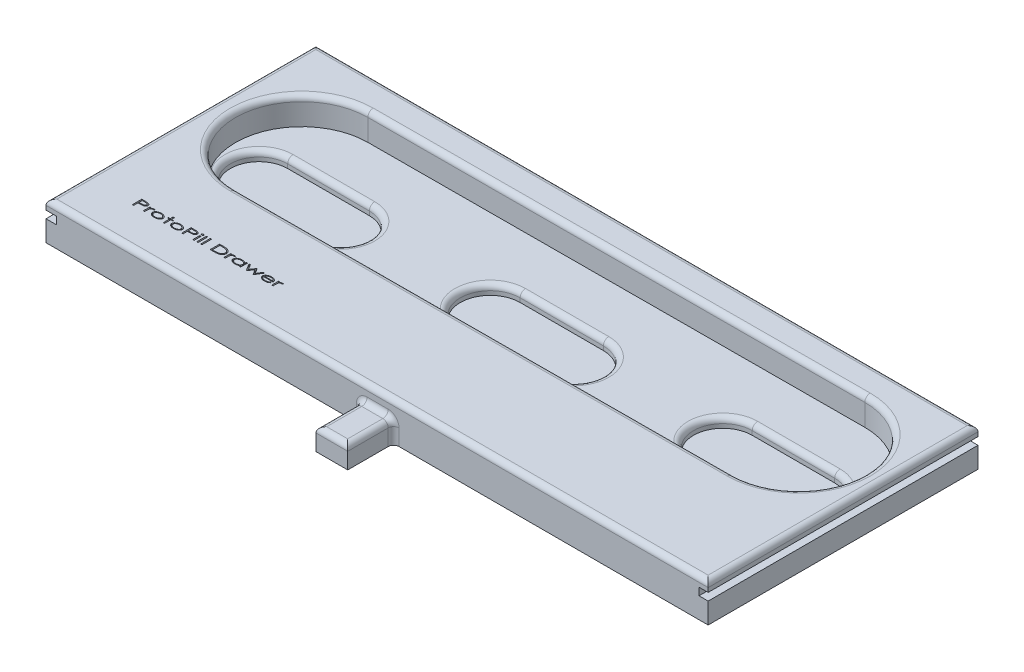
from build123d import *

# Parameters (mm, degrees)
SKETCH1_W           = 245.19434691
SKETCH1_H           = 93
BOSS_EXTRUDE1_DEPTH = 14
SKETCH2_W           = 4.694067914
SKETCH2_H           = 2.762668825
CUT_EXTRUDE1_DEPTH  = 264.350970101
SKETCH7_W           = 11.788952715
SKETCH7_H           = 7.980899871
BOSS_EXTRUDE2_DEPTH = 70
BOSS_EXTRUDE3_DEPTH = 53
CUT_EXTRUDE2_DEPTH  = 10
CUT_EXTRUDE4_DEPTH  = 3.5
FILLET2_R           = 2
FILLET3_R           = 2
SKETCH11_W          = 245.19434691
SKETCH11_H          = 46.073783244
CUT_EXTRUDE5_DEPTH  = 266.276293906
FILLET4_R           = 2
SKETCH12_R          = 3.025
CUT_EXTRUDE6_DEPTH  = 2
SKETCH13_W          = 0.493589743
SKETCH13_H          = 2.557692308
SKETCH13_H_2        = 3.58974359
CUT_EXTRUDE7_DEPTH  = 2
CUT_EXTRUDE8_DEPTH  = 2


with BuildPart() as part:
    # Sketch1 → Boss-Extrude1 (new body)
    with BuildSketch(Plane(origin=(0, 0, 0), x_dir=(1, 0, 0), z_dir=(0, 1, 0))):
        with Locations((123.388056697, 18.180222461)):
            Rectangle(SKETCH1_W, SKETCH1_H)
    extrude(amount=BOSS_EXTRUDE1_DEPTH)

    # Sketch2 → Cut-Extrude1 (cut, through all)
    with BuildSketch(Plane.XY.offset(28.319777539)):
        with Locations((2.347033957, 9.071542246)):
            Rectangle(SKETCH2_W, SKETCH2_H)
    cut_extrude1 = extrude(amount=-CUT_EXTRUDE1_DEPTH, mode=Mode.SUBTRACT)

    # Mirror5: Cut-Extrude1 across plane
    add(cut_extrude1.mirror(Plane(origin=(123.647335387, 0, 0), x_dir=(0, 0, 1), z_dir=(1, 0, 0))), mode=Mode.SUBTRACT)

    # Sketch7 → Boss-Extrude2 (add)
    with BuildSketch(Plane.XY.offset(28.319777539)):
        with Locations((123.619253178, 3.990449936)):
            Rectangle(SKETCH7_W, SKETCH7_H)
    extrude(amount=BOSS_EXTRUDE2_DEPTH)

    # Sketch8 → Boss-Extrude3 (add)
    with BuildSketch(Plane.XY.offset(28.319777539)):
        Polygon((245.985230152, 10.452876658), (245.985230152, 14), (0.790883242, 14), (0.790883242, 10.452876658), (4.694067914, 10.452876658), (4.694067914, 7.690207833), (0.790883242, 7.690207833), (0.790883242, 0), (117.72477682, 0), (117.72477682, 7.980899871), (129.513729535, 7.980899871), (129.513729535, 0), (245.985230152, 0), (245.985230152, 7.690207833), (242.60060286, 7.690207833), (242.60060286, 10.452876658), align=None)
    extrude(amount=BOSS_EXTRUDE3_DEPTH)

    # Sketch9 → Cut-Extrude2 (cut)
    with BuildSketch(Plane(origin=(0, 14, 0), x_dir=(1, 0, 0), z_dir=(0, 1, 0))):
        with BuildLine():
            Line((32.192967626, 6.462131645), (215.586098008, 7.089792499))
            ThreePointArc((215.586098008, 7.089792499), (240.21687673, -17.37296417), (215.754120062, -42.003742891))
            Line((215.754120062, -42.003742891), (32.360989679, -42.631403746))
            ThreePointArc((32.360989679, -42.631403746), (7.730210957, -18.168647077), (32.192967626, 6.462131645))
        make_face()
    extrude(amount=-CUT_EXTRUDE2_DEPTH, mode=Mode.SUBTRACT)

    # Sketch10 → Cut-Extrude4 (cut)
    with BuildSketch(Plane(origin=(0, 4, 0), x_dir=(1, 0, 0), z_dir=(0, 1, 0))):
        with BuildLine():
            Line((22.25591728, -13.271336062), (52.471076918, -13.271336062))
            ThreePointArc((52.471076918, -13.271336062), (63.102678482, -23.902937626), (52.471076918, -34.53453919))
            Line((52.471076918, -34.53453919), (22.25591728, -34.53453919))
            ThreePointArc((22.25591728, -34.53453919), (11.624315716, -23.902937626), (22.25591728, -13.271336062))
        make_face()
        with BuildLine():
            Line((108.253612411, -13.200304135), (139.069681283, -13.200304135))
            ThreePointArc((139.069681283, -13.200304135), (150.155917287, -24.286540139), (139.069681283, -35.372776144))
            Line((139.069681283, -35.372776144), (108.253612411, -35.372776144))
            ThreePointArc((108.253612411, -35.372776144), (97.167376406, -24.286540139), (108.253612411, -13.200304135))
        make_face()
        with BuildLine():
            Line((193.804446674, -12.815543396), (224.338324214, -12.815543396))
            ThreePointArc((224.338324214, -12.815543396), (235.209291929, -23.686511111), (224.338324214, -34.557478826))
            Line((224.338324214, -34.557478826), (193.804446674, -34.557478826))
            ThreePointArc((193.804446674, -34.557478826), (182.933478959, -23.686511111), (193.804446674, -12.815543396))
        make_face()
    extrude(amount=-CUT_EXTRUDE4_DEPTH, mode=Mode.SUBTRACT)

    # Fillet2
    fillet2_edges = [part.edges().sort_by_distance(p)[0] for p in [
        (240.21687673, 14, 17.37296417),
        (124.05755487, 14, 42.317573318),
        (7.730210957, 14, 18.168647077),
        (123.889532817, 14, -6.775962072),
    ]]
    fillet(fillet2_edges, radius=FILLET2_R)

    # Fillet3
    fillet3_edges = [part.edges().sort_by_distance(p)[0] for p in [
        (235.209291929, 4, 23.686511111),
        (209.071385444, 4, 34.557478826),
        (182.933478959, 4, 23.686511111),
        (150.155917287, 4, 24.286540139),
        (123.661646847, 4, 35.372776144),
        (97.167376406, 4, 24.286540139),
        (63.102678482, 4, 23.902937626),
        (37.363497099, 4, 34.53453919),
        (11.624315716, 4, 23.902937626),
        (209.071385444, 4, 12.815543396),
        (123.661646847, 4, 13.200304135),
        (37.363497099, 4, 13.271336062),
    ]]
    fillet(fillet3_edges, radius=FILLET3_R)

    # Sketch11 → Cut-Extrude5 (cut, through all)
    with BuildSketch(Plane(origin=(0, 14, 0), x_dir=(1, 0, 0), z_dir=(0, 1, 0))):
        with Locations((123.388056697, 41.643330839)):
            Rectangle(SKETCH11_W, SKETCH11_H)
    extrude(amount=-CUT_EXTRUDE5_DEPTH, mode=Mode.SUBTRACT)

    # Fillet4
    fillet4_edges = [part.edges().sort_by_distance(p)[0] for p in [
        (117.72477682, 3.990449936, 81.319777539),
        (129.513729535, 3.990449936, 81.319777539),
        (123.619253178, 7.980899871, 98.319777539),
        (117.72477682, 7.980899871, 89.819777539),
        (123.619253178, 7.980899871, 81.319777539),
        (129.513729535, 7.980899871, 89.819777539),
        (245.985230152, 14, 31.356669161),
        (123.388056697, 14, 81.319777539),
        (0.790883242, 14, 31.356669161),
        (123.388056697, 14, -18.606439217),
    ]]
    fillet(fillet4_edges, radius=FILLET4_R)

    # Sketch12 → Cut-Extrude6 (cut)
    with BuildSketch(Plane.XZ):
        with Locations((79.20490952, -2.654606068)):
            Circle(SKETCH12_R)
        with Locations((79.20490952, 6.341887825)):
            Circle(SKETCH12_R)
        with Locations((169.858472383, 5.930696377)):
            Circle(SKETCH12_R)
        with Locations((169.858472383, -2.654606068)):
            Circle(SKETCH12_R)
    extrude(amount=-CUT_EXTRUDE6_DEPTH, mode=Mode.SUBTRACT)

    # Sketch13 → Cut-Extrude7 (cut)
    # profile 1 of 16: a face of its own
    with BuildSketch(Plane(origin=(0, 14, 0), x_dir=(1, 0, 0), z_dir=(0, 1, 0))):
        with BuildLine():
            Line((18.559453652, -63.609154928), (19.589401569, -63.609154928))
            add(Edge.make_bspline(
                [(19.589401569, -63.609154928), (19.660216229, -63.609207816), (19.796009129, -63.609309233), (19.990458636, -63.612311088), (20.166922514, -63.616339403), (20.325381855, -63.621986437), (20.465916911, -63.628417575), (20.588361196, -63.637854069), (20.692806826, -63.647360425), (20.75610385, -63.657252292), (20.784814229, -63.661739063)],
                knots=[0, 0, 0, 0, 1.419177856, 2.721389515, 3.89734153, 4.956527438, 5.899121513, 6.716361902, 7.417765099, 8, 8, 8, 8], degree=3))
            add(Edge.make_bspline(
                [(20.784814229, -63.661739063), (20.820887054, -63.668358554), (20.892034872, -63.681414432), (20.995514197, -63.707401431), (21.093930167, -63.738080351), (21.187023764, -63.77418744), (21.275308065, -63.814482055), (21.358419454, -63.860319671), (21.436467741, -63.910896585), (21.509168984, -63.965877922), (21.575105371, -64.025007934), (21.632608856, -64.088601838), (21.680831646, -64.15611131), (21.721857181, -64.226827444), (21.752422367, -64.301981747), (21.774235543, -64.380809711), (21.788083956, -64.463099368), (21.789502804, -64.519389326), (21.790222883, -64.547957011)],
                knots=[0, 0, 0, 0, 1.202944546, 2.372613736, 3.497786956, 4.582770442, 5.646275108, 6.679186854, 7.693607135, 8.694962411, 9.666642172, 10.595006966, 11.501456956, 12.383984799, 13.271030618, 14.154656858, 15.063470898, 16, 16, 16, 16], degree=3))
            add(Edge.make_bspline(
                [(21.790222883, -64.547957011), (21.789521087, -64.576761689), (21.788143787, -64.633291905), (21.774119081, -64.716000476), (21.752660293, -64.794872573), (21.722045447, -64.869807261), (21.683557714, -64.941214738), (21.635074098, -65.00797268), (21.578906649, -65.07163001), (21.513310562, -65.129978091), (21.440869989, -65.18484635), (21.361600897, -65.235229344), (21.275762005, -65.280811287), (21.183647001, -65.321492741), (21.0849146, -65.357142972), (20.979859337, -65.388653778), (20.867916227, -65.415337146), (20.790732781, -65.429180671), (20.751160383, -65.436278326)],
                knots=[0, 0, 0, 0, 0.922605917, 1.810647271, 2.681294701, 3.538296812, 4.399903948, 5.275180805, 6.177331378, 7.116219832, 8.084190562, 9.088028358, 10.12368074, 11.197019002, 12.313319958, 13.4865942, 14.711362353, 16, 16, 16, 16], degree=3))
            add(Edge.make_bspline(
                [(20.751160383, -65.436278326), (20.718469229, -65.440942875), (20.646706534, -65.451182363), (20.529050496, -65.462594348), (20.392284803, -65.472278622), (20.236346099, -65.479638048), (20.061053197, -65.485869185), (19.866368667, -65.490814558), (19.65227691, -65.493557666), (19.503164369, -65.493697388), (19.425339069, -65.493770313)],
                knots=[0, 0, 0, 0, 0.596701069, 1.309861314, 2.135550679, 3.074303209, 4.130845578, 5.305332262, 6.593590277, 8, 8, 8, 8], degree=3))
            Line((19.425339069, -65.493770313), (19.053043395, -65.493770313))
            Line((19.053043395, -65.493770313), (19.053043395, -67.109154928))
            Line((19.053043395, -67.109154928), (18.559453652, -67.109154928))
            Line((18.559453652, -67.109154928), (18.559453652, -63.609154928))
        make_face()
        with BuildLine():
            Line((19.053043395, -63.968129287), (19.053043395, -65.134795954))
            Line((19.053043395, -65.134795954), (19.953984902, -65.142508294))
            add(Edge.make_bspline(
                [(19.953984902, -65.142508294), (19.99792553, -65.142521334), (20.08301808, -65.142546588), (20.205949603, -65.138570661), (20.319804463, -65.134014923), (20.424328313, -65.127165764), (20.519658494, -65.117805993), (20.606116267, -65.108019692), (20.683188352, -65.094359518), (20.772402579, -65.075649298), (20.871574629, -65.044704061), (20.978955012, -64.998076538), (21.07224247, -64.940131325), (21.152027991, -64.873727987), (21.216190155, -64.800096138), (21.262354089, -64.720428976), (21.291409318, -64.636401283), (21.294894643, -64.578326983), (21.296633139, -64.549359255)],
                knots=[0, 0, 0, 0, 1.302178146, 2.521713123, 3.644833948, 4.679186471, 5.625468095, 6.483724746, 7.256908744, 7.944332482, 9.184328887, 10.328545311, 11.404879146, 12.427406377, 13.395044434, 14.282513672, 15.143309921, 16, 16, 16, 16], degree=3))
            add(Edge.make_bspline(
                [(21.296633139, -64.549359255), (21.29488017, -64.521086999), (21.291349857, -64.464149342), (21.26214629, -64.381617706), (21.216240367, -64.302719484), (21.151826402, -64.230387849), (21.074420468, -64.163622302), (20.983396781, -64.107713567), (20.881682484, -64.060904428), (20.787456502, -64.032245262), (20.703325252, -64.013994903), (20.629883554, -64.00148467), (20.546835613, -63.991071106), (20.454427444, -63.983061843), (20.352767544, -63.975873783), (20.2417168, -63.971162183), (20.121100984, -63.968331153), (20.037420139, -63.968198302), (19.993948844, -63.968129287)],
                knots=[0, 0, 0, 0, 0.85982624, 1.731608922, 2.638175506, 3.627963027, 4.668731374, 5.743984735, 6.872385735, 8.073309669, 8.737023245, 9.49590589, 10.343247817, 11.287432573, 12.322799246, 13.449422509, 14.675002546, 16, 16, 16, 16], degree=3))
            Line((19.993948844, -63.968129287), (19.053043395, -63.968129287))
        make_face(mode=Mode.SUBTRACT)
    # profile 2 of 16: a face of its own
    with BuildSketch(Plane(origin=(0, 14, 0), x_dir=(1, 0, 0), z_dir=(0, 1, 0))):
        with BuildLine():
            Line((22.553043395, -64.55146262), (23.046633139, -64.55146262))
            Line((23.046633139, -64.55146262), (23.046633139, -64.927965024))
            add(Edge.make_bspline(
                [(23.046633139, -64.927965024), (23.082885879, -64.892621444), (23.153638365, -64.823643314), (23.268351063, -64.735386097), (23.385694455, -64.662111951), (23.506193525, -64.604249484), (23.629883275, -64.560946567), (23.755528933, -64.528912548), (23.884155021, -64.510398001), (23.970654507, -64.507865291), (24.014181216, -64.506590826)],
                knots=[0, 0, 0, 0, 1.118950737, 2.183794828, 3.193525129, 4.173720819, 5.133313879, 6.087280825, 7.037516007, 8, 8, 8, 8], degree=3))
            add(Edge.make_bspline(
                [(24.014181216, -64.506590826), (24.047897414, -64.507756469), (24.116628327, -64.510132648), (24.221300531, -64.527311932), (24.329395531, -64.554260942), (24.400953974, -64.580679867), (24.43765878, -64.59423105)],
                knots=[0, 0, 0, 0, 0.930225898, 1.896277749, 2.920927934, 4, 4, 4, 4], degree=3))
            Line((24.43765878, -64.59423105), (24.180347081, -64.866266306))
            add(Edge.make_bspline(
                [(24.180347081, -64.866266306), (24.156566026, -64.8595064), (24.111129946, -64.846590924), (24.045503081, -64.831561132), (23.985450915, -64.822594083), (23.94736645, -64.821303889), (23.929345479, -64.82069339)],
                knots=[0, 0, 0, 0, 1.159041688, 2.214464814, 3.155112748, 4, 4, 4, 4], degree=3))
            add(Edge.make_bspline(
                [(23.929345479, -64.82069339), (23.889948104, -64.822308073), (23.811047254, -64.825541788), (23.694185274, -64.85207983), (23.579705378, -64.894632173), (23.487625223, -64.943250947), (23.416756228, -64.990378929), (23.366448084, -65.031120689), (23.31903889, -65.076135863), (23.275521831, -65.126404123), (23.234924036, -65.180976511), (23.197579829, -65.240229473), (23.163881393, -65.304021263), (23.144708599, -65.348959682), (23.134974485, -65.37177512)],
                knots=[0, 0, 0, 0, 1.378395564, 2.76050325, 4.1743034, 5.645969789, 6.395007641, 7.151651941, 7.909932039, 8.681347296, 9.476827634, 10.289673222, 11.131659355, 12, 12, 12, 12], degree=3))
            add(Edge.make_bspline(
                [(23.134974485, -65.37177512), (23.127503484, -65.391971011), (23.111112, -65.436281085), (23.095135155, -65.512110019), (23.079205605, -65.601073056), (23.068303686, -65.704210737), (23.05820614, -65.820818827), (23.051559556, -65.951306742), (23.047331348, -66.095771336), (23.04687292, -66.196758208), (23.046633139, -66.249579608)],
                knots=[0, 0, 0, 0, 0.582572936, 1.278173338, 2.094113426, 3.030890954, 4.085475449, 5.26463872, 6.569263414, 8, 8, 8, 8], degree=3))
            Line((23.046633139, -66.249579608), (23.046633139, -67.109154928))
            Line((23.046633139, -67.109154928), (22.553043395, -67.109154928))
            Line((22.553043395, -67.109154928), (22.553043395, -64.55146262))
        make_face()
    # profile 3 of 16: a face of its own
    with BuildSketch(Plane(origin=(0, 14, 0), x_dir=(1, 0, 0), z_dir=(0, 1, 0))):
        with BuildLine():
            add(Edge.make_bspline(
                [(26.705787786, -64.506590826), (26.778056125, -64.507620156), (26.919621695, -64.509636499), (27.126898032, -64.530782568), (27.324628677, -64.563483241), (27.513377302, -64.608619596), (27.692408154, -64.66845597), (27.862235557, -64.74094608), (28.023182204, -64.825847595), (28.122431681, -64.894027991), (28.17183346, -64.927965024)],
                knots=[0, 0, 0, 0, 1.118029041, 2.190093497, 3.220499173, 4.217871291, 5.190012594, 6.137901036, 7.073133634, 8, 8, 8, 8], degree=3))
            add(Edge.make_bspline(
                [(28.17183346, -64.927965024), (28.213892898, -64.959851367), (28.295495735, -65.021716578), (28.402860552, -65.125435073), (28.494480251, -65.232803882), (28.5706408, -65.344323998), (28.62815826, -65.461728169), (28.670374378, -65.582809314), (28.695535165, -65.708678755), (28.698822316, -65.794207131), (28.700479293, -65.837319992)],
                knots=[0, 0, 0, 0, 1.156785325, 2.244370538, 3.266277709, 4.248660306, 5.197713603, 6.124949243, 7.054830596, 8, 8, 8, 8], degree=3))
            add(Edge.make_bspline(
                [(28.700479293, -65.837319992), (28.699020086, -65.880703477), (28.696120562, -65.966908882), (28.66788985, -66.09349869), (28.624199892, -66.21614742), (28.562685996, -66.334591252), (28.482768178, -66.448186173), (28.386329221, -66.55792718), (28.271324793, -66.662406192), (28.141405488, -66.762376644), (27.997864786, -66.85478944), (27.842118278, -66.934486584), (27.677093059, -67.00267444), (27.501834157, -67.058149076), (27.316887289, -67.10139543), (27.121923564, -67.13201863), (26.917181777, -67.150431683), (26.777341111, -67.152809862), (26.705787786, -67.154026723)],
                knots=[0, 0, 0, 0, 0.789098804, 1.567983354, 2.350210273, 3.155490411, 3.990287269, 4.874001324, 5.810856407, 6.815460693, 7.856857624, 8.915312001, 9.997439552, 11.105303834, 12.259580059, 13.453399675, 14.696961864, 16, 16, 16, 16], degree=3))
            add(Edge.make_bspline(
                [(26.705787786, -67.154026723), (26.634001021, -67.152802883), (26.493461475, -67.150406928), (26.287787586, -67.132042599), (26.092089603, -67.101519473), (25.90655601, -67.05787591), (25.730646128, -67.002978447), (25.565261375, -66.93445207), (25.409501235, -66.854798449), (25.265964077, -66.762374335), (25.136043872, -66.662406757), (25.021039664, -66.557927043), (24.924600654, -66.448186207), (24.844682849, -66.334591243), (24.783168949, -66.216147422), (24.739478992, -66.093498689), (24.71124828, -65.966908882), (24.708348756, -65.880703477), (24.706889549, -65.837319992)],
                knots=[0, 0, 0, 0, 1.305249044, 2.555333257, 3.751483921, 4.903955647, 6.018189604, 7.098625447, 8.155425126, 9.195194025, 10.198227797, 11.13361828, 12.01595081, 12.849442617, 13.653463848, 14.434467899, 15.212134806, 16, 16, 16, 16], degree=3))
            add(Edge.make_bspline(
                [(24.706889549, -65.837319992), (24.708552832, -65.794438612), (24.711861398, -65.709139906), (24.737074533, -65.583550181), (24.778871813, -65.462378766), (24.837664002, -65.346083449), (24.913193078, -65.234555112), (25.0040698, -65.126875384), (25.112150179, -65.023875406), (25.193526394, -64.962006886), (25.235535383, -64.93006839)],
                knots=[0, 0, 0, 0, 0.94172135, 1.873251586, 2.802131417, 3.750562843, 4.727561346, 5.755201045, 6.841163442, 8, 8, 8, 8], degree=3))
            add(Edge.make_bspline(
                [(25.235535383, -64.93006839), (25.284901741, -64.895839515), (25.383973083, -64.827146974), (25.545486729, -64.742381433), (25.715300151, -64.669073341), (25.89502493, -64.609467936), (26.084251711, -64.563161903), (26.28307383, -64.530923748), (26.491247685, -64.509606196), (26.633283682, -64.507609874), (26.705787786, -64.506590826)],
                knots=[0, 0, 0, 0, 0.925913955, 1.858179155, 2.807793909, 3.776850706, 4.775415181, 5.809663793, 6.881914668, 8, 8, 8, 8], degree=3))
        make_face()
        with BuildLine():
            add(Edge.make_bspline(
                [(26.703684421, -64.82069339), (26.653170058, -64.821651672), (26.553813524, -64.823536516), (26.407422979, -64.837958465), (26.266381666, -64.860892765), (26.13053942, -64.892936964), (26.000513614, -64.935200454), (25.875881416, -64.986660045), (25.756217794, -65.04679942), (25.643966715, -65.116470587), (25.540614354, -65.191698546), (25.450401465, -65.272734905), (25.373244793, -65.356884317), (25.30969161, -65.445275626), (25.26095542, -65.538352301), (25.226535498, -65.63539395), (25.204319933, -65.736059107), (25.201768787, -65.804718817), (25.200479293, -65.839423358)],
                knots=[0, 0, 0, 0, 1.211834855, 2.383553959, 3.525731113, 4.638274302, 5.728838459, 6.802447438, 7.870742288, 8.938271609, 9.968951287, 10.933831991, 11.842871365, 12.70331083, 13.538512719, 14.354385004, 15.168212155, 16, 16, 16, 16], degree=3))
            add(Edge.make_bspline(
                [(25.200479293, -65.839423358), (25.20128811, -65.861880838), (25.202903686, -65.906738615), (25.211779163, -65.973589969), (25.228617652, -66.039026504), (25.249815833, -66.103954003), (25.279245117, -66.166862968), (25.313370433, -66.229252417), (25.355453121, -66.289287174), (25.402115492, -66.348842837), (25.454227927, -66.406224097), (25.512325206, -66.459095498), (25.57354613, -66.510381481), (25.639753494, -66.557531786), (25.710618066, -66.601296414), (25.785477085, -66.641895197), (25.864869786, -66.679042672), (25.977124962, -66.724188783), (26.124887989, -66.770886307), (26.310590114, -66.810534687), (26.504322999, -66.836050577), (26.636529128, -66.838619335), (26.703684421, -66.839924159)],
                knots=[0, 0, 0, 0, 0.676698543, 1.351674039, 2.02606196, 2.70946426, 3.405653627, 4.114679009, 4.848838336, 5.610721482, 6.392982434, 7.180011484, 7.97496537, 8.797371187, 9.625630927, 10.482387151, 11.360987975, 12.264255974, 14.125429088, 16.019773843, 17.978208304, 20, 20, 20, 20], degree=3))
            add(Edge.make_bspline(
                [(26.703684421, -66.839924159), (26.770841079, -66.838623222), (26.903049896, -66.836062115), (27.096763322, -66.810490823), (27.282318068, -66.771090107), (27.429868494, -66.723812046), (27.542331492, -66.679211051), (27.621892969, -66.641887292), (27.696719417, -66.601256356), (27.767572894, -66.557792182), (27.83322779, -66.50991138), (27.895013712, -66.459355254), (27.953174172, -66.406232613), (28.005119145, -66.348566936), (28.052867782, -66.289794691), (28.093633261, -66.22875016), (28.129281063, -66.16732038), (28.157020189, -66.103563808), (28.180038595, -66.039332866), (28.194990878, -65.973378644), (28.205663819, -65.906846209), (28.206480891, -65.861902107), (28.206889549, -65.839423358)],
                knots=[0, 0, 0, 0, 2.021608502, 3.979865511, 5.874038621, 7.728335502, 8.638053201, 9.516574416, 10.373253009, 11.201437702, 12.018055674, 12.818372735, 13.605330473, 14.387520545, 15.15371191, 15.883845854, 16.596257792, 17.289495649, 17.975116066, 18.647787728, 19.323692347, 20, 20, 20, 20], degree=3))
            add(Edge.make_bspline(
                [(28.206889549, -65.839423358), (28.205604326, -65.804716578), (28.203061631, -65.736052439), (28.180783686, -65.63541998), (28.146565943, -65.538150381), (28.09683336, -65.445470458), (28.033463413, -65.356873821), (27.956213394, -65.272527733), (27.865310898, -65.191705357), (27.761397088, -65.116662108), (27.649064475, -65.046774554), (27.529379625, -64.986666237), (27.404752744, -64.935200672), (27.274727078, -64.892929588), (27.139103341, -64.860975962), (26.998549546, -64.837944566), (26.852854913, -64.82353935), (26.753964996, -64.821652671), (26.703684421, -64.82069339)],
                knots=[0, 0, 0, 0, 0.832069071, 1.646171375, 2.462319504, 3.300417048, 4.161147425, 5.070494144, 6.03988092, 7.075430977, 8.143321227, 9.211977265, 10.285949229, 11.376882104, 12.489801441, 13.626829931, 14.793361768, 16, 16, 16, 16], degree=3))
        make_face(mode=Mode.SUBTRACT)
    # profile 4 of 16: a face of its own
    with BuildSketch(Plane(origin=(0, 14, 0), x_dir=(1, 0, 0), z_dir=(0, 1, 0))):
        Polygon((30.046633139, -63.519411338), (30.540222883, -63.519411338), (30.540222883, -64.55146262), (31.303043395, -64.55146262), (31.303043395, -64.865565185), (30.540222883, -64.865565185), (30.540222883, -67.109154928), (30.046633139, -67.109154928), (30.046633139, -64.865565185), (29.373556216, -64.865565185), (29.373556216, -64.55146262), (30.046633139, -64.55146262), align=None)
    # profile 5 of 16: a face of its own
    with BuildSketch(Plane(origin=(0, 14, 0), x_dir=(1, 0, 0), z_dir=(0, 1, 0))):
        with BuildLine():
            add(Edge.make_bspline(
                [(33.840403171, -64.506590826), (33.91267151, -64.507620156), (34.054237079, -64.509636499), (34.261513416, -64.530782568), (34.459244062, -64.563483241), (34.647992687, -64.608619596), (34.827023539, -64.66845597), (34.996850942, -64.74094608), (35.157797589, -64.825847595), (35.257047065, -64.894027991), (35.306448844, -64.927965024)],
                knots=[0, 0, 0, 0, 1.118029041, 2.190093497, 3.220499173, 4.217871291, 5.190012594, 6.137901036, 7.073133634, 8, 8, 8, 8], degree=3))
            add(Edge.make_bspline(
                [(35.306448844, -64.927965024), (35.348508282, -64.959851367), (35.430111119, -65.021716578), (35.537475937, -65.125435073), (35.629095636, -65.232803882), (35.705256185, -65.344323998), (35.762773644, -65.461728169), (35.804989762, -65.582809314), (35.83015055, -65.708678755), (35.833437701, -65.794207131), (35.835094678, -65.837319992)],
                knots=[0, 0, 0, 0, 1.156785325, 2.244370538, 3.266277709, 4.248660306, 5.197713603, 6.124949243, 7.054830596, 8, 8, 8, 8], degree=3))
            add(Edge.make_bspline(
                [(35.835094678, -65.837319992), (35.833635471, -65.880703477), (35.830735946, -65.966908882), (35.802505235, -66.09349869), (35.758815277, -66.21614742), (35.697301381, -66.334591252), (35.617383562, -66.448186173), (35.520944606, -66.55792718), (35.405940177, -66.662406192), (35.276020873, -66.762376644), (35.13248017, -66.85478944), (34.976733663, -66.934486584), (34.811708444, -67.00267444), (34.636449541, -67.058149076), (34.451502674, -67.10139543), (34.256538949, -67.13201863), (34.051797161, -67.150431683), (33.911956496, -67.152809862), (33.840403171, -67.154026723)],
                knots=[0, 0, 0, 0, 0.789098804, 1.567983354, 2.350210273, 3.155490411, 3.990287269, 4.874001324, 5.810856407, 6.815460693, 7.856857624, 8.915312001, 9.997439552, 11.105303834, 12.259580059, 13.453399675, 14.696961864, 16, 16, 16, 16], degree=3))
            add(Edge.make_bspline(
                [(33.840403171, -67.154026723), (33.768616406, -67.152802883), (33.62807686, -67.150406928), (33.422402971, -67.132042599), (33.226704988, -67.101519473), (33.041171394, -67.05787591), (32.865261513, -67.002978447), (32.699876759, -66.93445207), (32.544116619, -66.854798449), (32.400579462, -66.762374335), (32.270659257, -66.662406757), (32.155655049, -66.557927043), (32.059216039, -66.448186207), (31.979298233, -66.334591243), (31.917784334, -66.216147422), (31.874094377, -66.093498689), (31.845863665, -65.966908882), (31.84296414, -65.880703477), (31.841504934, -65.837319992)],
                knots=[0, 0, 0, 0, 1.305249044, 2.555333257, 3.751483921, 4.903955647, 6.018189604, 7.098625447, 8.155425126, 9.195194025, 10.198227797, 11.13361828, 12.01595081, 12.849442617, 13.653463848, 14.434467899, 15.212134806, 16, 16, 16, 16], degree=3))
            add(Edge.make_bspline(
                [(31.841504934, -65.837319992), (31.843168217, -65.794438612), (31.846476782, -65.709139906), (31.871689918, -65.583550181), (31.913487198, -65.462378766), (31.972279386, -65.346083449), (32.047808463, -65.234555112), (32.138685185, -65.126875384), (32.246765564, -65.023875406), (32.328141779, -64.962006886), (32.370150767, -64.93006839)],
                knots=[0, 0, 0, 0, 0.94172135, 1.873251586, 2.802131417, 3.750562843, 4.727561346, 5.755201045, 6.841163442, 8, 8, 8, 8], degree=3))
            add(Edge.make_bspline(
                [(32.370150767, -64.93006839), (32.419517126, -64.895839515), (32.518588467, -64.827146974), (32.680102113, -64.742381433), (32.849915535, -64.669073341), (33.029640315, -64.609467936), (33.218867096, -64.563161903), (33.417689214, -64.530923748), (33.62586307, -64.509606196), (33.767899067, -64.507609874), (33.840403171, -64.506590826)],
                knots=[0, 0, 0, 0, 0.925913955, 1.858179155, 2.807793909, 3.776850706, 4.775415181, 5.809663793, 6.881914668, 8, 8, 8, 8], degree=3))
        make_face()
        with BuildLine():
            add(Edge.make_bspline(
                [(33.838299806, -64.82069339), (33.787785443, -64.821651672), (33.688428909, -64.823536516), (33.542038364, -64.837958465), (33.400997051, -64.860892765), (33.265154804, -64.892936964), (33.135128999, -64.935200454), (33.010496801, -64.986660045), (32.890833179, -65.04679942), (32.7785821, -65.116470587), (32.675229739, -65.191698546), (32.585016849, -65.272734905), (32.507860177, -65.356884317), (32.444306995, -65.445275626), (32.395570804, -65.538352301), (32.361150883, -65.63539395), (32.338935317, -65.736059107), (32.336384172, -65.804718817), (32.335094678, -65.839423358)],
                knots=[0, 0, 0, 0, 1.211834855, 2.383553959, 3.525731113, 4.638274302, 5.728838459, 6.802447438, 7.870742288, 8.938271609, 9.968951287, 10.933831991, 11.842871365, 12.70331083, 13.538512719, 14.354385004, 15.168212155, 16, 16, 16, 16], degree=3))
            add(Edge.make_bspline(
                [(32.335094678, -65.839423358), (32.335903495, -65.861880838), (32.337519071, -65.906738615), (32.346394547, -65.973589969), (32.363233036, -66.039026504), (32.384431218, -66.103954003), (32.413860502, -66.166862968), (32.447985817, -66.229252417), (32.490068505, -66.289287174), (32.536730877, -66.348842837), (32.588843311, -66.406224097), (32.646940591, -66.459095498), (32.708161514, -66.510381481), (32.774368878, -66.557531786), (32.84523345, -66.601296414), (32.920092469, -66.641895197), (32.999485171, -66.679042672), (33.111740347, -66.724188783), (33.259503373, -66.770886307), (33.445205499, -66.810534687), (33.638938383, -66.836050577), (33.771144513, -66.838619335), (33.838299806, -66.839924159)],
                knots=[0, 0, 0, 0, 0.676698543, 1.351674039, 2.02606196, 2.70946426, 3.405653627, 4.114679009, 4.848838336, 5.610721482, 6.392982434, 7.180011484, 7.97496537, 8.797371187, 9.625630927, 10.482387151, 11.360987975, 12.264255974, 14.125429088, 16.019773843, 17.978208304, 20, 20, 20, 20], degree=3))
            add(Edge.make_bspline(
                [(33.838299806, -66.839924159), (33.905456464, -66.838623222), (34.03766528, -66.836062115), (34.231378706, -66.810490823), (34.416933453, -66.771090107), (34.564483879, -66.723812046), (34.676946876, -66.679211051), (34.756508354, -66.641887292), (34.831334801, -66.601256356), (34.902188279, -66.557792182), (34.967843174, -66.50991138), (35.029629097, -66.459355254), (35.087789556, -66.406232613), (35.13973453, -66.348566936), (35.187483167, -66.289794691), (35.228248646, -66.22875016), (35.263896448, -66.16732038), (35.291635574, -66.103563808), (35.314653979, -66.039332866), (35.329606263, -65.973378644), (35.340279203, -65.906846209), (35.341096276, -65.861902107), (35.341504934, -65.839423358)],
                knots=[0, 0, 0, 0, 2.021608502, 3.979865511, 5.874038621, 7.728335502, 8.638053201, 9.516574416, 10.373253009, 11.201437702, 12.018055674, 12.818372735, 13.605330473, 14.387520545, 15.15371191, 15.883845854, 16.596257792, 17.289495649, 17.975116066, 18.647787728, 19.323692347, 20, 20, 20, 20], degree=3))
            add(Edge.make_bspline(
                [(35.341504934, -65.839423358), (35.340219711, -65.804716578), (35.337677016, -65.736052439), (35.31539907, -65.63541998), (35.281181328, -65.538150381), (35.231448744, -65.445470458), (35.168078797, -65.356873821), (35.090828779, -65.272527733), (34.999926282, -65.191705357), (34.896012472, -65.116662108), (34.78367986, -65.046774554), (34.663995009, -64.986666237), (34.539368128, -64.935200672), (34.409342463, -64.892929588), (34.273718725, -64.860975962), (34.133164931, -64.837944566), (33.987470297, -64.82353935), (33.88858038, -64.821652671), (33.838299806, -64.82069339)],
                knots=[0, 0, 0, 0, 0.832069071, 1.646171375, 2.462319504, 3.300417048, 4.161147425, 5.070494144, 6.03988092, 7.075430977, 8.143321227, 9.211977265, 10.285949229, 11.376882104, 12.489801441, 13.626829931, 14.793361768, 16, 16, 16, 16], degree=3))
        make_face(mode=Mode.SUBTRACT)
    # profile 6 of 16: a face of its own
    with BuildSketch(Plane(origin=(0, 14, 0), x_dir=(1, 0, 0), z_dir=(0, 1, 0))):
        with BuildLine():
            Line((36.822274165, -63.609154928), (37.852222081, -63.609154928))
            add(Edge.make_bspline(
                [(37.852222081, -63.609154928), (37.923036742, -63.609207816), (38.058829642, -63.609309233), (38.253279149, -63.612311088), (38.429743027, -63.616339403), (38.588202368, -63.621986437), (38.728737424, -63.628417575), (38.851181709, -63.637854069), (38.955627339, -63.647360425), (39.018924363, -63.657252292), (39.047634742, -63.661739063)],
                knots=[0, 0, 0, 0, 1.419177856, 2.721389515, 3.89734153, 4.956527438, 5.899121513, 6.716361902, 7.417765099, 8, 8, 8, 8], degree=3))
            add(Edge.make_bspline(
                [(39.047634742, -63.661739063), (39.083707567, -63.668358554), (39.154855385, -63.681414432), (39.25833471, -63.707401431), (39.35675068, -63.738080351), (39.449844277, -63.77418744), (39.538128578, -63.814482055), (39.621239966, -63.860319671), (39.699288254, -63.910896585), (39.771989497, -63.965877922), (39.837925884, -64.025007934), (39.895429369, -64.088601838), (39.943652158, -64.15611131), (39.984677694, -64.226827444), (40.01524288, -64.301981747), (40.037056055, -64.380809711), (40.050904469, -64.463099368), (40.052323317, -64.519389326), (40.053043395, -64.547957011)],
                knots=[0, 0, 0, 0, 1.202944546, 2.372613736, 3.497786956, 4.582770442, 5.646275108, 6.679186854, 7.693607135, 8.694962411, 9.666642172, 10.595006966, 11.501456956, 12.383984799, 13.271030618, 14.154656858, 15.063470898, 16, 16, 16, 16], degree=3))
            add(Edge.make_bspline(
                [(40.053043395, -64.547957011), (40.0523416, -64.576761689), (40.0509643, -64.633291905), (40.036939593, -64.716000476), (40.015480806, -64.794872573), (39.984865959, -64.869807261), (39.946378227, -64.941214738), (39.897894611, -65.00797268), (39.841727161, -65.07163001), (39.776131075, -65.129978091), (39.703690502, -65.18484635), (39.62442141, -65.235229344), (39.538582518, -65.280811287), (39.446467514, -65.321492741), (39.347735113, -65.357142972), (39.24267985, -65.388653778), (39.130736739, -65.415337146), (39.053553293, -65.429180671), (39.013980895, -65.436278326)],
                knots=[0, 0, 0, 0, 0.922605917, 1.810647271, 2.681294701, 3.538296812, 4.399903948, 5.275180805, 6.177331378, 7.116219832, 8.084190562, 9.088028358, 10.12368074, 11.197019002, 12.313319958, 13.4865942, 14.711362353, 16, 16, 16, 16], degree=3))
            add(Edge.make_bspline(
                [(39.013980895, -65.436278326), (38.981289742, -65.440942875), (38.909527047, -65.451182363), (38.791871009, -65.462594348), (38.655105316, -65.472278622), (38.499166612, -65.479638048), (38.32387371, -65.485869185), (38.12918918, -65.490814558), (37.915097422, -65.493557666), (37.765984882, -65.493697388), (37.688159581, -65.493770313)],
                knots=[0, 0, 0, 0, 0.596701069, 1.309861314, 2.135550679, 3.074303209, 4.130845578, 5.305332262, 6.593590277, 8, 8, 8, 8], degree=3))
            Line((37.688159581, -65.493770313), (37.315863908, -65.493770313))
            Line((37.315863908, -65.493770313), (37.315863908, -67.109154928))
            Line((37.315863908, -67.109154928), (36.822274165, -67.109154928))
            Line((36.822274165, -67.109154928), (36.822274165, -63.609154928))
        make_face()
        with BuildLine():
            Line((37.315863908, -63.968129287), (37.315863908, -65.134795954))
            Line((37.315863908, -65.134795954), (38.216805415, -65.142508294))
            add(Edge.make_bspline(
                [(38.216805415, -65.142508294), (38.260746043, -65.142521334), (38.345838593, -65.142546588), (38.468770116, -65.138570661), (38.582624975, -65.134014923), (38.687148826, -65.127165764), (38.782479007, -65.117805993), (38.86893678, -65.108019692), (38.946008865, -65.094359518), (39.035223092, -65.075649298), (39.134395142, -65.044704061), (39.241775524, -64.998076538), (39.335062983, -64.940131325), (39.414848504, -64.873727987), (39.479010668, -64.800096138), (39.525174602, -64.720428976), (39.554229831, -64.636401283), (39.557715156, -64.578326983), (39.559453652, -64.549359255)],
                knots=[0, 0, 0, 0, 1.302178146, 2.521713123, 3.644833948, 4.679186471, 5.625468095, 6.483724746, 7.256908744, 7.944332482, 9.184328887, 10.328545311, 11.404879146, 12.427406377, 13.395044434, 14.282513672, 15.143309921, 16, 16, 16, 16], degree=3))
            add(Edge.make_bspline(
                [(39.559453652, -64.549359255), (39.557700683, -64.521086999), (39.554170369, -64.464149342), (39.524966803, -64.381617706), (39.47906088, -64.302719484), (39.414646915, -64.230387849), (39.337240981, -64.163622302), (39.246217293, -64.107713567), (39.144502997, -64.060904428), (39.050277015, -64.032245262), (38.966145765, -64.013994903), (38.892704067, -64.00148467), (38.809656126, -63.991071106), (38.717247957, -63.983061843), (38.615588056, -63.975873783), (38.504537313, -63.971162183), (38.383921497, -63.968331153), (38.300240652, -63.968198302), (38.256769357, -63.968129287)],
                knots=[0, 0, 0, 0, 0.85982624, 1.731608922, 2.638175506, 3.627963027, 4.668731374, 5.743984735, 6.872385735, 8.073309669, 8.737023245, 9.49590589, 10.343247817, 11.287432573, 12.322799246, 13.449422509, 14.675002546, 16, 16, 16, 16], degree=3))
            Line((38.256769357, -63.968129287), (37.315863908, -63.968129287))
        make_face(mode=Mode.SUBTRACT)
    # profile 7 of 16: a face of its own
    with BuildSketch(Plane(origin=(0, 14, 0), x_dir=(1, 0, 0), z_dir=(0, 1, 0))):
        with BuildLine():
            add(Edge.make_bspline(
                [(41.195170799, -63.474539544), (41.223742293, -63.475444808), (41.279186456, -63.47720151), (41.359164795, -63.491819245), (41.432178837, -63.517540909), (41.497355041, -63.551134641), (41.552523123, -63.591527922), (41.592788877, -63.638471284), (41.619361021, -63.690084533), (41.622163424, -63.7268835), (41.623556216, -63.745172556)],
                knots=[0, 0, 0, 0, 1.232622349, 2.391954591, 3.492533549, 4.561789548, 5.54829387, 6.421376584, 7.215425493, 8, 8, 8, 8], degree=3))
            add(Edge.make_bspline(
                [(41.623556216, -63.745172556), (41.622129336, -63.762989159), (41.619237592, -63.79909666), (41.592764511, -63.849828547), (41.552271135, -63.896017197), (41.497388245, -63.936437233), (41.43216936, -63.969990798), (41.359167501, -63.995723927), (41.279185714, -64.010338417), (41.22374204, -64.01209558), (41.195170799, -64.013001082)],
                knots=[0, 0, 0, 0, 0.768134372, 1.55671721, 2.426123539, 3.417176527, 4.491362752, 5.597016362, 6.761694161, 8, 8, 8, 8], degree=3))
            add(Edge.make_bspline(
                [(41.195170799, -64.013001082), (41.167299701, -64.012088189), (41.113015682, -64.010310165), (41.034441435, -63.995641492), (40.962203204, -63.969837117), (40.897154989, -63.936450047), (40.842278337, -63.896014323), (40.80178356, -63.849829196), (40.775310798, -63.799096509), (40.772419013, -63.762989109), (40.770992113, -63.745172556)],
                knots=[0, 0, 0, 0, 1.217058856, 2.370442829, 3.474794704, 4.557074952, 5.555595552, 6.431552882, 7.226077714, 8, 8, 8, 8], degree=3))
            add(Edge.make_bspline(
                [(40.770992113, -63.745172556), (40.772384926, -63.726883552), (40.77518737, -63.690084689), (40.801759191, -63.638470624), (40.842026358, -63.59153082), (40.897188205, -63.551121842), (40.962193812, -63.517694669), (41.034444082, -63.491901625), (41.113014965, -63.477229785), (41.167299458, -63.475452207), (41.195170799, -63.474539544)],
                knots=[0, 0, 0, 0, 0.790458961, 1.590463383, 2.470094379, 3.463997666, 4.541273283, 5.640518464, 6.788569012, 8, 8, 8, 8], degree=3))
        make_face()
    # profile 8 of 16: a face of its own
    with BuildSketch(Plane(origin=(0, 14, 0), x_dir=(1, 0, 0), z_dir=(0, 1, 0))):
        with Locations((41.197274165, -65.830308774)):
            Rectangle(SKETCH13_W, SKETCH13_H)
    # profile 9 of 16: a face of its own
    with BuildSketch(Plane(origin=(0, 14, 0), x_dir=(1, 0, 0), z_dir=(0, 1, 0))):
        with Locations((42.633171601, -65.314283133)):
            Rectangle(SKETCH13_W, SKETCH13_H_2)
    # profile 10 of 16: a face of its own
    with BuildSketch(Plane(origin=(0, 14, 0), x_dir=(1, 0, 0), z_dir=(0, 1, 0))):
        with Locations((44.069069037, -65.314283133)):
            Rectangle(SKETCH13_W, SKETCH13_H_2)
    # profile 11 of 16: a face of its own
    with BuildSketch(Plane(origin=(0, 14, 0), x_dir=(1, 0, 0), z_dir=(0, 1, 0))):
        with BuildLine():
            Line((47.36714596, -67.109154928), (47.36714596, -63.609154928))
            Line((47.36714596, -63.609154928), (48.438460062, -63.609154928))
            add(Edge.make_bspline(
                [(48.438460062, -63.609154928), (48.531712009, -63.609594491), (48.711689613, -63.610442853), (48.971851243, -63.615895212), (49.212171661, -63.625396635), (49.432590558, -63.639513457), (49.633032827, -63.656451712), (49.813573226, -63.678081235), (49.974404016, -63.703247199), (50.074263118, -63.725097127), (50.12115237, -63.735356851)],
                knots=[0, 0, 0, 0, 1.323813521, 2.554979188, 3.693909684, 4.737789415, 5.690279757, 6.54911815, 7.318732465, 8, 8, 8, 8], degree=3))
            add(Edge.make_bspline(
                [(50.12115237, -63.735356851), (50.182360785, -63.750727059), (50.302289439, -63.780842662), (50.47510584, -63.837934848), (50.63743565, -63.903410911), (50.790380521, -63.975703775), (50.931875258, -64.058538865), (51.064820416, -64.147100164), (51.186111181, -64.245737983), (51.297114502, -64.351616929), (51.396649223, -64.463823474), (51.482778392, -64.582568992), (51.556053676, -64.706153808), (51.616102467, -64.835272179), (51.66268865, -64.96989436), (51.695126289, -65.109985297), (51.716599116, -65.254959753), (51.718664648, -65.353468165), (51.719710062, -65.403325601)],
                knots=[0, 0, 0, 0, 1.207798654, 2.366499211, 3.480576359, 4.557146755, 5.601517647, 6.616536575, 7.612203728, 8.589979544, 9.55040618, 10.479294148, 11.393893687, 12.296620384, 13.200709655, 14.115506133, 15.04621312, 16, 16, 16, 16], degree=3))
            add(Edge.make_bspline(
                [(51.719710062, -65.403325601), (51.71893028, -65.44662001), (51.717390347, -65.532118874), (51.70024112, -65.657973096), (51.674873544, -65.780195858), (51.637216344, -65.898018322), (51.590084674, -66.012342778), (51.53255743, -66.122909801), (51.463341196, -66.228750322), (51.38472431, -66.330215054), (51.298266291, -66.426557074), (51.204295017, -66.516438037), (51.105296567, -66.600746353), (50.998948774, -66.677434843), (50.887067496, -66.74843722), (50.768192025, -66.811937669), (50.643543087, -66.869819765), (50.511351032, -66.921417693), (50.369248869, -66.966514904), (50.214925451, -67.005008441), (50.047228204, -67.036725523), (49.865936723, -67.063218635), (49.671362091, -67.084174925), (49.463202803, -67.098401362), (49.241800204, -67.107872409), (49.089579057, -67.108719292), (49.011276569, -67.109154928)],
                knots=[0, 0, 0, 0, 0.867583375, 1.713324997, 2.542387203, 3.367932116, 4.189477015, 5.019531976, 5.863128609, 6.721742731, 7.591172003, 8.456207664, 9.327453716, 10.196390289, 11.083089667, 11.982588127, 12.896750361, 13.837492442, 14.826032314, 15.884199514, 17.024778466, 18.246884326, 19.557235698, 20.947863052, 22.429982155, 24, 24, 24, 24], degree=3))
            Line((49.011276569, -67.109154928), (47.36714596, -67.109154928))
        make_face()
        with BuildLine():
            Line((47.860735703, -66.750180569), (48.463700447, -66.750180569))
            add(Edge.make_bspline(
                [(48.463700447, -66.750180569), (48.550407656, -66.749934964), (48.716821888, -66.749463582), (48.95616186, -66.745259824), (49.174708879, -66.738427089), (49.37271188, -66.728874591), (49.549883598, -66.71619384), (49.706396613, -66.702106612), (49.842167294, -66.684499735), (49.925133013, -66.668512174), (49.963399966, -66.661138101)],
                knots=[0, 0, 0, 0, 1.383279688, 2.654882197, 3.818759855, 4.871481191, 5.817166586, 6.652292251, 7.378385793, 8, 8, 8, 8], degree=3))
            add(Edge.make_bspline(
                [(49.963399966, -66.661138101), (50.011186753, -66.649900503), (50.105041787, -66.62782944), (50.241009103, -66.587803159), (50.36838981, -66.539255854), (50.488739138, -66.486822737), (50.600589123, -66.425799165), (50.70498325, -66.359779234), (50.801333549, -66.286791684), (50.889427588, -66.207922208), (50.968761515, -66.123588853), (51.03706997, -66.033750412), (51.095875592, -65.940178438), (51.144034391, -65.841593247), (51.180096557, -65.737828321), (51.207238232, -65.63024341), (51.222644147, -65.51781855), (51.224948247, -65.441464821), (51.226120319, -65.402624479)],
                knots=[0, 0, 0, 0, 1.213921113, 2.384186417, 3.50166985, 4.583183161, 5.627935832, 6.649229357, 7.63522774, 8.613403315, 9.570260051, 10.49386413, 11.399942308, 12.29947164, 13.200651912, 14.111784984, 15.039484809, 16, 16, 16, 16], degree=3))
            add(Edge.make_bspline(
                [(51.226120319, -65.402624479), (51.225164489, -65.361653507), (51.223281928, -65.280958781), (51.204746311, -65.162709599), (51.177133933, -65.048797063), (51.136823711, -64.939456945), (51.084560482, -64.834968598), (51.021777525, -64.734416325), (50.947039959, -64.639039909), (50.861283864, -64.54852776), (50.765322475, -64.46414008), (50.660407906, -64.385833697), (50.546112391, -64.315173186), (50.423418459, -64.250271267), (50.290797228, -64.193980968), (50.149854108, -64.143152042), (49.999496542, -64.100679796), (49.89575075, -64.077907524), (49.842807017, -64.066286338)],
                knots=[0, 0, 0, 0, 0.937479559, 1.846420823, 2.734195072, 3.61797647, 4.508263293, 5.405088182, 6.327834881, 7.277997599, 8.256154844, 9.250457072, 10.272077141, 11.330106498, 12.425583743, 13.568150063, 14.758974123, 16, 16, 16, 16], degree=3))
            add(Edge.make_bspline(
                [(49.842807017, -64.066286338), (49.798702837, -64.058152015), (49.704301647, -64.040741196), (49.551849118, -64.022169849), (49.38002734, -64.005402586), (49.18833763, -63.991414461), (48.976757528, -63.981340846), (48.74536129, -63.973768644), (48.494105175, -63.968655685), (48.319973182, -63.968309238), (48.229525767, -63.968129287)],
                knots=[0, 0, 0, 0, 0.664968389, 1.423307427, 2.276521454, 3.225252385, 4.273249474, 5.41763715, 6.658672415, 8, 8, 8, 8], degree=3))
            Line((48.229525767, -63.968129287), (47.860735703, -63.968129287))
            Line((47.860735703, -63.968129287), (47.860735703, -66.750180569))
        make_face(mode=Mode.SUBTRACT)
    # profile 12 of 16: a face of its own
    with BuildSketch(Plane(origin=(0, 14, 0), x_dir=(1, 0, 0), z_dir=(0, 1, 0))):
        with BuildLine():
            Line((52.43765878, -64.55146262), (52.931248524, -64.55146262))
            Line((52.931248524, -64.55146262), (52.931248524, -64.927965024))
            add(Edge.make_bspline(
                [(52.931248524, -64.927965024), (52.967501264, -64.892621444), (53.03825375, -64.823643314), (53.152966447, -64.735386097), (53.270309839, -64.662111951), (53.39080891, -64.604249484), (53.51449866, -64.560946567), (53.640144318, -64.528912548), (53.768770406, -64.510398001), (53.855269892, -64.507865291), (53.898796601, -64.506590826)],
                knots=[0, 0, 0, 0, 1.118950737, 2.183794828, 3.193525129, 4.173720819, 5.133313879, 6.087280825, 7.037516007, 8, 8, 8, 8], degree=3))
            add(Edge.make_bspline(
                [(53.898796601, -64.506590826), (53.932512798, -64.507756469), (54.001243711, -64.510132648), (54.105915916, -64.527311932), (54.214010916, -64.554260942), (54.285569359, -64.580679867), (54.322274165, -64.59423105)],
                knots=[0, 0, 0, 0, 0.930225898, 1.896277749, 2.920927934, 4, 4, 4, 4], degree=3))
            Line((54.322274165, -64.59423105), (54.064962466, -64.866266306))
            add(Edge.make_bspline(
                [(54.064962466, -64.866266306), (54.04118141, -64.8595064), (53.99574533, -64.846590924), (53.930118466, -64.831561132), (53.8700663, -64.822594083), (53.831981835, -64.821303889), (53.813960863, -64.82069339)],
                knots=[0, 0, 0, 0, 1.159041688, 2.214464814, 3.155112748, 4, 4, 4, 4], degree=3))
            add(Edge.make_bspline(
                [(53.813960863, -64.82069339), (53.774563489, -64.822308073), (53.695662639, -64.825541788), (53.578800659, -64.85207983), (53.464320762, -64.894632173), (53.372240607, -64.943250947), (53.301371612, -64.990378929), (53.251063469, -65.031120689), (53.203654275, -65.076135863), (53.160137216, -65.126404123), (53.119539421, -65.180976511), (53.082195214, -65.240229473), (53.048496778, -65.304021263), (53.029323984, -65.348959682), (53.01958987, -65.37177512)],
                knots=[0, 0, 0, 0, 1.378395564, 2.76050325, 4.1743034, 5.645969789, 6.395007641, 7.151651941, 7.909932039, 8.681347296, 9.476827634, 10.289673222, 11.131659355, 12, 12, 12, 12], degree=3))
            add(Edge.make_bspline(
                [(53.01958987, -65.37177512), (53.012118868, -65.391971011), (52.995727384, -65.436281085), (52.97975054, -65.512110019), (52.963820989, -65.601073056), (52.952919071, -65.704210737), (52.942821525, -65.820818827), (52.936174941, -65.951306742), (52.931946732, -66.095771336), (52.931488305, -66.196758208), (52.931248524, -66.249579608)],
                knots=[0, 0, 0, 0, 0.582572936, 1.278173338, 2.094113426, 3.030890954, 4.085475449, 5.26463872, 6.569263414, 8, 8, 8, 8], degree=3))
            Line((52.931248524, -66.249579608), (52.931248524, -67.109154928))
            Line((52.931248524, -67.109154928), (52.43765878, -67.109154928))
            Line((52.43765878, -67.109154928), (52.43765878, -64.55146262))
        make_face()
    # profile 13 of 16: a face of its own
    with BuildSketch(Plane(origin=(0, 14, 0), x_dir=(1, 0, 0), z_dir=(0, 1, 0))):
        with BuildLine():
            Line((58.629966472, -64.55146262), (58.629966472, -67.109154928))
            Line((58.629966472, -67.109154928), (58.136376729, -67.109154928))
            Line((58.136376729, -67.109154928), (58.136376729, -66.666747076))
            add(Edge.make_bspline(
                [(58.136376729, -66.666747076), (58.083405025, -66.707144972), (57.977740519, -66.787728067), (57.80516538, -66.888334084), (57.623576286, -66.973052459), (57.432019869, -67.040222741), (57.23150627, -67.091139072), (57.022160476, -67.127216323), (56.803840868, -67.150570325), (56.654967572, -67.152860788), (56.579185222, -67.154026723)],
                knots=[0, 0, 0, 0, 0.959950057, 1.9148459, 2.87384884, 3.846004085, 4.837560737, 5.853778905, 6.907489231, 8, 8, 8, 8], degree=3))
            add(Edge.make_bspline(
                [(56.579185222, -67.154026723), (56.511834357, -67.15281249), (56.379452071, -67.150425841), (56.184595544, -67.131673367), (55.997367817, -67.101949123), (55.817336407, -67.059734305), (55.644987842, -67.005276263), (55.480074165, -66.9381943), (55.322411488, -66.859814105), (55.174528406, -66.769213218), (55.038813222, -66.671014904), (54.919093167, -66.566671181), (54.818569116, -66.455680116), (54.735700408, -66.339672541), (54.671016296, -66.218093368), (54.625010515, -66.09118191), (54.596619229, -65.95893555), (54.593219728, -65.868776207), (54.591504934, -65.823297556)],
                knots=[0, 0, 0, 0, 1.226021397, 2.409820796, 3.560528837, 4.675169253, 5.773241012, 6.84782229, 7.91342823, 8.975196037, 10.001589918, 10.960246305, 11.860978357, 12.721634312, 13.549600474, 14.359895992, 15.172690086, 16, 16, 16, 16], degree=3))
            add(Edge.make_bspline(
                [(54.591504934, -65.823297556), (54.593250564, -65.77875867), (54.596720224, -65.690232002), (54.624839457, -65.560131313), (54.671970306, -65.435271195), (54.737055308, -65.315614638), (54.820162251, -65.200830653), (54.922486921, -65.091848358), (55.042735011, -64.987633697), (55.179593468, -64.889779885), (55.32894941, -64.80019106), (55.487797498, -64.721723646), (55.653795233, -64.654555584), (55.827808982, -64.60104822), (56.008748713, -64.55793434), (56.197417144, -64.528002604), (56.393285918, -64.510456485), (56.526331604, -64.507892922), (56.59390878, -64.506590826)],
                knots=[0, 0, 0, 0, 0.810112008, 1.610200051, 2.409779071, 3.23202922, 4.082076825, 4.982045036, 5.946842608, 6.973913408, 8.040473165, 9.113409892, 10.195590852, 11.296150651, 12.423889662, 13.578489405, 14.770055223, 16, 16, 16, 16], degree=3))
            add(Edge.make_bspline(
                [(56.59390878, -64.506590826), (56.671553579, -64.508040068), (56.823694877, -64.510879789), (57.04602767, -64.534002364), (57.256890349, -64.573565992), (57.424657527, -64.618589097), (57.552918238, -64.662502718), (57.645129823, -64.70052421), (57.734240862, -64.743688682), (57.820961072, -64.790064138), (57.904322652, -64.841912414), (57.984944422, -64.897910003), (58.062794342, -64.958645051), (58.111850294, -65.002695828), (58.136376729, -65.024719832)],
                knots=[0, 0, 0, 0, 1.676518641, 3.285058718, 4.820346399, 6.305438499, 7.031660956, 7.746785142, 8.457855071, 9.169193615, 9.869488998, 10.576517448, 11.288303459, 12, 12, 12, 12], degree=3))
            Line((58.136376729, -65.024719832), (58.136376729, -64.55146262))
            Line((58.136376729, -64.55146262), (58.629966472, -64.55146262))
        make_face()
        with BuildLine():
            add(Edge.make_bspline(
                [(56.612839069, -64.82069339), (56.54522419, -64.822321038), (56.412111003, -64.825525385), (56.216342831, -64.850522536), (56.028387984, -64.891868097), (55.878199338, -64.939962954), (55.763663038, -64.985602899), (55.682751928, -65.023700461), (55.606230752, -65.064798365), (55.534665585, -65.11002267), (55.466996408, -65.157661521), (55.403774714, -65.208736038), (55.345417031, -65.263785808), (55.291625533, -65.321524741), (55.243692312, -65.381527442), (55.201048158, -65.442114807), (55.164850461, -65.503812834), (55.136655089, -65.567185612), (55.112641083, -65.630551755), (55.096629327, -65.695267224), (55.08746877, -65.760868379), (55.085886683, -65.804807091), (55.085094678, -65.826803165)],
                knots=[0, 0, 0, 0, 2.015899916, 3.96869549, 5.874422764, 7.747889721, 8.664177198, 9.549623601, 10.413438996, 11.252669112, 12.072577075, 12.880219075, 13.67403036, 14.463085208, 15.231525746, 15.962352479, 16.671215476, 17.360484384, 18.02856856, 18.689489262, 19.343947753, 20, 20, 20, 20], degree=3))
            add(Edge.make_bspline(
                [(55.085094678, -65.826803165), (55.085833407, -65.848571438), (55.087318112, -65.892321507), (55.097367439, -65.957400377), (55.113830259, -66.021850188), (55.135923213, -66.085749502), (55.166181395, -66.148450478), (55.201622763, -66.210824288), (55.244410458, -66.27224131), (55.29283022, -66.332738955), (55.347740152, -66.390555294), (55.406503497, -66.446069556), (55.469875698, -66.49822646), (55.53797748, -66.5464638), (55.610649849, -66.591487653), (55.687613135, -66.633475517), (55.769098206, -66.672047462), (55.883753255, -66.718796776), (56.03311856, -66.768112251), (56.21968193, -66.809040151), (56.412039074, -66.835263678), (56.542641418, -66.838359765), (56.608632338, -66.839924159)],
                knots=[0, 0, 0, 0, 0.649936462, 1.30624811, 1.961259946, 2.63442162, 3.32119113, 4.037021866, 4.774532588, 5.553782938, 6.348626026, 7.153333487, 7.966439378, 8.797143028, 9.643383336, 10.517785088, 11.413671548, 12.333773708, 14.213980314, 16.101747765, 18.030286096, 20, 20, 20, 20], degree=3))
            add(Edge.make_bspline(
                [(56.608632338, -66.839924159), (56.67554496, -66.838271112), (56.80818627, -66.834994266), (57.004389282, -66.80990737), (57.195128412, -66.768499351), (57.349031871, -66.720370508), (57.466541306, -66.673267964), (57.550356527, -66.636701353), (57.628265265, -66.595622922), (57.70126492, -66.55241439), (57.769096322, -66.505966049), (57.831163973, -66.456240302), (57.888689726, -66.404133199), (57.940251135, -66.348825326), (57.98681256, -66.291451256), (58.026966839, -66.231630197), (58.060715762, -66.169875557), (58.088026149, -66.106386527), (58.110211285, -66.041577096), (58.125513901, -65.974620072), (58.134935582, -65.905834559), (58.135894384, -65.859318555), (58.136376729, -65.835917749)],
                knots=[0, 0, 0, 0, 1.987519312, 3.939871941, 5.865572077, 7.78042679, 8.721641852, 9.626132954, 10.495705138, 11.336384455, 12.1452667, 12.935762171, 13.69752979, 14.449103521, 15.179961946, 15.89055288, 16.586543186, 17.267584541, 17.941653079, 18.61871876, 19.305118843, 20, 20, 20, 20], degree=3))
            add(Edge.make_bspline(
                [(58.136376729, -65.835917749), (58.135008398, -65.800529391), (58.132303015, -65.730561601), (58.111308137, -65.627853637), (58.076916412, -65.529558157), (58.027589897, -65.436273487), (57.965269952, -65.347198242), (57.888941192, -65.26271342), (57.798227258, -65.18365748), (57.69584081, -65.109019706), (57.582930781, -65.042241329), (57.463465135, -64.98173894), (57.336914789, -64.932433403), (57.20423694, -64.891692233), (57.065410655, -64.859111541), (56.919986866, -64.837538343), (56.76856802, -64.822546688), (56.665461935, -64.821319644), (56.612839069, -64.82069339)],
                knots=[0, 0, 0, 0, 0.838952033, 1.658726862, 2.475797891, 3.301530857, 4.153550984, 5.048566245, 5.995133624, 7.00310499, 8.049891089, 9.103583459, 10.176296665, 11.267009123, 12.393921279, 13.555125413, 14.752194814, 16, 16, 16, 16], degree=3))
        make_face(mode=Mode.SUBTRACT)
    # profile 14 of 16: a face of its own
    with BuildSketch(Plane(origin=(0, 14, 0), x_dir=(1, 0, 0), z_dir=(0, 1, 0))):
        Polygon((59.168428011, -64.55146262), (59.705487306, -64.55146262), (60.851120319, -66.39120621), (62.039521761, -64.55146262), (62.184653972, -64.55146262), (63.363940831, -66.39120621), (64.520791793, -64.55146262), (65.046633139, -64.55146262), (63.43755862, -67.109154928), (63.286817434, -67.109154928), (62.107530575, -65.269411338), (60.918428011, -67.109154928), (60.760675607, -67.109154928), align=None)
    # profile 15 of 16: a face of its own
    with BuildSketch(Plane(origin=(0, 14, 0), x_dir=(1, 0, 0), z_dir=(0, 1, 0))):
        with BuildLine():
            Line((68.893688428, -66.30146262), (69.309453652, -66.447997076))
            add(Edge.make_bspline(
                [(69.309453652, -66.447997076), (69.274884665, -66.487713482), (69.206416741, -66.566376473), (69.091567689, -66.671708984), (68.969767922, -66.766204963), (68.838885073, -66.847610237), (68.700589377, -66.918691618), (68.554160943, -66.980262727), (68.39964479, -67.033638274), (68.236224653, -67.078019434), (68.063082921, -67.112224054), (67.879494566, -67.136466122), (67.684969556, -67.151402251), (67.551535272, -67.153136418), (67.483031376, -67.154026723)],
                knots=[0, 0, 0, 0, 0.935356925, 1.852583867, 2.764980882, 3.672151338, 4.588182607, 5.526468892, 6.493453783, 7.492196994, 8.534274985, 9.628299183, 10.782391289, 12, 12, 12, 12], degree=3))
            add(Edge.make_bspline(
                [(67.483031376, -67.154026723), (67.407269446, -67.152878803), (67.259704281, -67.150642943), (67.044912918, -67.131500306), (66.842699414, -67.100210592), (66.653135426, -67.056485422), (66.476036367, -66.999511393), (66.311478459, -66.930420142), (66.159628267, -66.848118962), (66.022276581, -66.753575529), (65.899472402, -66.651529286), (65.791386806, -66.545811525), (65.700056535, -66.436079246), (65.625891502, -66.322574737), (65.567691224, -66.206180371), (65.52558956, -66.086443498), (65.500371806, -65.962941272), (65.497027577, -65.87926671), (65.495351088, -65.837319992)],
                knots=[0, 0, 0, 0, 1.379293914, 2.686517258, 3.92274962, 5.102580987, 6.224936263, 7.306161049, 8.347779058, 9.364054048, 10.337164078, 11.251934907, 12.113353819, 12.931306227, 13.715381605, 14.47711699, 15.236566735, 16, 16, 16, 16], degree=3))
            add(Edge.make_bspline(
                [(65.495351088, -65.837319992), (65.496705512, -65.79797015), (65.499401676, -65.719638958), (65.520945591, -65.603816289), (65.557452393, -65.491646884), (65.606517575, -65.382078076), (65.671137252, -65.276541361), (65.74985067, -65.174561771), (65.841749048, -65.075094846), (65.911666053, -65.014483141), (65.947574645, -64.983353646)],
                knots=[0, 0, 0, 0, 0.944293904, 1.879744906, 2.816641919, 3.770901605, 4.755300812, 5.779894712, 6.859778713, 8, 8, 8, 8], degree=3))
            add(Edge.make_bspline(
                [(65.947574645, -64.983353646), (65.996639135, -64.94519058), (66.095310623, -64.868442477), (66.257642412, -64.770798247), (66.43275374, -64.689862974), (66.61904679, -64.621976588), (66.81784959, -64.570855719), (67.028154171, -64.532492246), (67.250988606, -64.51123075), (67.403528306, -64.508162024), (67.481629133, -64.506590826)],
                knots=[0, 0, 0, 0, 0.909396737, 1.828848728, 2.765573699, 3.729890337, 4.727376251, 5.766908938, 6.856650047, 8, 8, 8, 8], degree=3))
            add(Edge.make_bspline(
                [(67.481629133, -64.506590826), (67.562087966, -64.507930462), (67.719169985, -64.510545871), (67.948369394, -64.53501625), (68.165261492, -64.573927042), (68.370037916, -64.628296506), (68.562486293, -64.699091744), (68.741902747, -64.786571951), (68.909821653, -64.888648648), (69.011340187, -64.969622466), (69.061957658, -65.009996274)],
                knots=[0, 0, 0, 0, 1.139620897, 2.224913567, 3.261470301, 4.259030804, 5.222856815, 6.161738278, 7.08343673, 8, 8, 8, 8], degree=3))
            add(Edge.make_bspline(
                [(69.061957658, -65.009996274), (69.095537781, -65.039962547), (69.161255559, -65.098607861), (69.247646474, -65.196217238), (69.319821617, -65.300010751), (69.381017961, -65.408286043), (69.428284648, -65.522729781), (69.461742588, -65.642808095), (69.48341614, -65.768317413), (69.487079709, -65.85405903), (69.488940831, -65.897616467)],
                knots=[0, 0, 0, 0, 1.060847693, 2.076125639, 3.065487378, 4.037719101, 5.004010916, 5.977679051, 6.972644549, 8, 8, 8, 8], degree=3))
            Line((69.488940831, -65.897616467), (65.988940831, -65.897616467))
            add(Edge.make_bspline(
                [(65.988940831, -65.897616467), (65.991271696, -65.931399169), (65.995884814, -65.998260011), (66.01921079, -66.095525499), (66.053493821, -66.188365484), (66.101092313, -66.276061964), (66.161550663, -66.35869277), (66.234197045, -66.436619365), (66.319298703, -66.50980119), (66.41542177, -66.578073299), (66.521532383, -66.638778753), (66.633837639, -66.693085983), (66.752439705, -66.738939783), (66.877250676, -66.775789032), (67.007991913, -66.80460958), (67.144608564, -66.824534624), (67.287161541, -66.837685288), (67.38437659, -66.839168018), (67.433952851, -66.839924159)],
                knots=[0, 0, 0, 0, 0.853309836, 1.688823266, 2.513736016, 3.345012842, 4.197955707, 5.091062549, 6.027630919, 7.025902121, 8.061795113, 9.109059866, 10.171494079, 11.26687929, 12.390234416, 13.54715085, 14.74913306, 16, 16, 16, 16], degree=3))
            add(Edge.make_bspline(
                [(67.433952851, -66.839924159), (67.482585942, -66.839314172), (67.579049537, -66.838104264), (67.72276208, -66.826448902), (67.864092415, -66.807586731), (68.002134168, -66.781721149), (68.134095989, -66.750294886), (68.256987111, -66.712026552), (68.370030281, -66.670674395), (68.475062507, -66.622347067), (68.577189059, -66.563980609), (68.679428572, -66.489923094), (68.787661317, -66.403245795), (68.857285108, -66.336408828), (68.893688428, -66.30146262)],
                knots=[0, 0, 0, 0, 1.093367176, 2.168690603, 3.239652219, 4.298164291, 5.325470396, 6.287891767, 7.190798283, 8.030193578, 8.884717855, 9.830992595, 10.86591825, 12, 12, 12, 12], degree=3))
        make_face()
        with BuildLine():
            add(Edge.make_bspline(
                [(68.995351088, -65.583513903), (68.97750516, -65.541606991), (68.942613566, -65.459672393), (68.872852274, -65.348038881), (68.791856015, -65.249574516), (68.697933242, -65.164066836), (68.590819333, -65.088870012), (68.468567863, -65.022412009), (68.330586977, -64.963848285), (68.17895648, -64.913773823), (68.01803554, -64.871458528), (67.850729158, -64.842870096), (67.679572637, -64.823393071), (67.563949829, -64.821600221), (67.505467274, -64.82069339)],
                knots=[0, 0, 0, 0, 0.92011432, 1.798968077, 2.651730975, 3.491490357, 4.359703351, 5.292647224, 6.300626296, 7.38733791, 8.520067401, 9.662460721, 10.817661747, 12, 12, 12, 12], degree=3))
            add(Edge.make_bspline(
                [(67.505467274, -64.82069339), (67.457535626, -64.821293072), (67.363404904, -64.82247076), (67.224786768, -64.833927885), (67.09163835, -64.852920278), (66.963080501, -64.878444027), (66.840187822, -64.913277864), (66.721495897, -64.953536416), (66.608544978, -65.002507081), (66.536956402, -65.041261541), (66.501460863, -65.060477044)],
                knots=[0, 0, 0, 0, 1.101754776, 2.163684692, 3.194775476, 4.192630449, 5.1742102, 6.129121442, 7.072368164, 8, 8, 8, 8], degree=3))
            add(Edge.make_bspline(
                [(66.501460863, -65.060477044), (66.476385079, -65.07544537), (66.426488102, -65.10523005), (66.357206772, -65.157909985), (66.291574849, -65.214541458), (66.230841704, -65.277274705), (66.175790512, -65.346347519), (66.124491151, -65.419967852), (66.077503337, -65.498921947), (66.051332921, -65.554990425), (66.038019357, -65.583513903)],
                knots=[0, 0, 0, 0, 0.985213069, 1.960423394, 2.93349289, 3.909979084, 4.903153156, 5.912153346, 6.937858655, 8, 8, 8, 8], degree=3))
            Line((66.038019357, -65.583513903), (68.995351088, -65.583513903))
        make_face(mode=Mode.SUBTRACT)
    # profile 16 of 16: a face of its own
    with BuildSketch(Plane(origin=(0, 14, 0), x_dir=(1, 0, 0), z_dir=(0, 1, 0))):
        with BuildLine():
            Line((70.162017754, -64.55146262), (70.655607498, -64.55146262))
            Line((70.655607498, -64.55146262), (70.655607498, -64.927965024))
            add(Edge.make_bspline(
                [(70.655607498, -64.927965024), (70.691860238, -64.892621444), (70.762612724, -64.823643314), (70.877325422, -64.735386097), (70.994668813, -64.662111951), (71.115167884, -64.604249484), (71.238857634, -64.560946567), (71.364503292, -64.528912548), (71.49312938, -64.510398001), (71.579628866, -64.507865291), (71.623155575, -64.506590826)],
                knots=[0, 0, 0, 0, 1.118950737, 2.183794828, 3.193525129, 4.173720819, 5.133313879, 6.087280825, 7.037516007, 8, 8, 8, 8], degree=3))
            add(Edge.make_bspline(
                [(71.623155575, -64.506590826), (71.656871773, -64.507756469), (71.725602686, -64.510132648), (71.83027489, -64.527311932), (71.93836989, -64.554260942), (72.009928333, -64.580679867), (72.046633139, -64.59423105)],
                knots=[0, 0, 0, 0, 0.930225898, 1.896277749, 2.920927934, 4, 4, 4, 4], degree=3))
            Line((72.046633139, -64.59423105), (71.78932144, -64.866266306))
            add(Edge.make_bspline(
                [(71.78932144, -64.866266306), (71.765540385, -64.8595064), (71.720104305, -64.846590924), (71.65447744, -64.831561132), (71.594425274, -64.822594083), (71.556340809, -64.821303889), (71.538319838, -64.82069339)],
                knots=[0, 0, 0, 0, 1.159041688, 2.214464814, 3.155112748, 4, 4, 4, 4], degree=3))
            add(Edge.make_bspline(
                [(71.538319838, -64.82069339), (71.498922463, -64.822308073), (71.420021613, -64.825541788), (71.303159633, -64.85207983), (71.188679737, -64.894632173), (71.096599582, -64.943250947), (71.025730587, -64.990378929), (70.975422443, -65.031120689), (70.928013249, -65.076135863), (70.88449619, -65.126404123), (70.843898395, -65.180976511), (70.806554188, -65.240229473), (70.772855752, -65.304021263), (70.753682958, -65.348959682), (70.743948844, -65.37177512)],
                knots=[0, 0, 0, 0, 1.378395564, 2.76050325, 4.1743034, 5.645969789, 6.395007641, 7.151651941, 7.909932039, 8.681347296, 9.476827634, 10.289673222, 11.131659355, 12, 12, 12, 12], degree=3))
            add(Edge.make_bspline(
                [(70.743948844, -65.37177512), (70.736477843, -65.391971011), (70.720086359, -65.436281085), (70.704109514, -65.512110019), (70.688179964, -65.601073056), (70.677278045, -65.704210737), (70.667180499, -65.820818827), (70.660533915, -65.951306742), (70.656305707, -66.095771336), (70.655847279, -66.196758208), (70.655607498, -66.249579608)],
                knots=[0, 0, 0, 0, 0.582572936, 1.278173338, 2.094113426, 3.030890954, 4.085475449, 5.26463872, 6.569263414, 8, 8, 8, 8], degree=3))
            Line((70.655607498, -66.249579608), (70.655607498, -67.109154928))
            Line((70.655607498, -67.109154928), (70.162017754, -67.109154928))
            Line((70.162017754, -67.109154928), (70.162017754, -64.55146262))
        make_face()
    extrude(amount=-CUT_EXTRUDE7_DEPTH, mode=Mode.SUBTRACT)

    # Sketch14 → Cut-Extrude8 (cut)
    with BuildSketch(Plane.XZ):
        Polygon((76.147523237, 6.139331249), (79.172523237, 12.817811701), (82.197523237, 6.139331249), align=None)
        Polygon((76.147523237, -2.857162644), (79.172523237, -9.535643097), (82.197523237, -2.857162644), align=None)
        Polygon((166.8010861, 5.728139801), (169.8260861, 12.406620254), (172.8510861, 5.728139801), align=None)
        Polygon((166.8010861, -2.857162644), (169.8260861, -9.535643097), (172.8510861, -2.857162644), align=None)
    extrude(amount=-CUT_EXTRUDE8_DEPTH, mode=Mode.SUBTRACT)


solid = part.part
